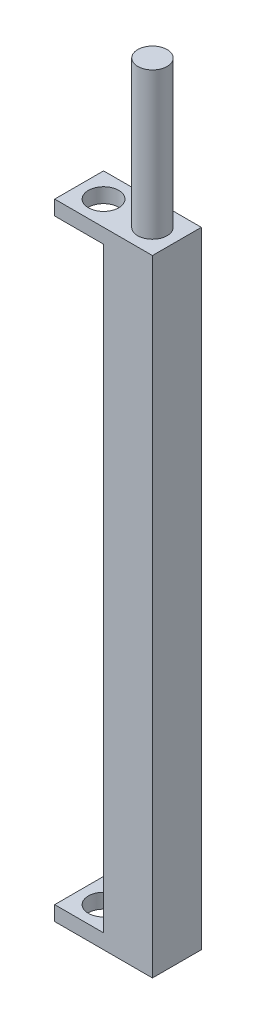
from build123d import *

# Parameters (mm, degrees)
SKETCH_2_W          = 10
SKETCH_2_H          = 5
EXTRUDE_1_DEPTH     = 1.5
SKETCH_3_R          = 1.55
CUT_EXTRUDE_1_DEPTH = 1.5
SKETCH_4_W          = 5
SKETCH_4_H          = 5
EXTRUDE_2_DEPTH     = 61
SKETCH_5_W          = 10
SKETCH_5_H          = 5
EXTRUDE_3_DEPTH     = 1.5
SKETCH_6_R          = 1.55
CUT_EXTRUDE_2_DEPTH = 1.5
SKETCH_7_R          = 1.5
EXTRUDE_4_DEPTH     = 15
SKETCH_11_R         = 1.55
CUT_EXTRUDE_3_DEPTH = 1


with BuildPart() as part:
    # 草图2 → 凸台-拉伸1 (new body)
    with BuildSketch(Plane(origin=(0, 0, 0), x_dir=(1, 0, 0), z_dir=(0, 1, 0))):
        Rectangle(SKETCH_2_W, SKETCH_2_H)
    extrude(amount=EXTRUDE_1_DEPTH)

    # 草图3 → 切除-拉伸1 (cut)
    with BuildSketch(Plane.XZ):
        with Locations((-2.5, 0)):
            Circle(SKETCH_3_R)
    extrude(amount=-CUT_EXTRUDE_1_DEPTH, mode=Mode.SUBTRACT)

    # 草图4 → 凸台-拉伸2 (add)
    with BuildSketch(Plane.XZ):
        with Locations((2.5, 0)):
            Rectangle(SKETCH_4_W, SKETCH_4_H)
    extrude(amount=EXTRUDE_2_DEPTH)

    # 草图5 → 凸台-拉伸3 (add)
    with BuildSketch(Plane.XZ.offset(61)):
        Rectangle(SKETCH_5_W, SKETCH_5_H)
    extrude(amount=EXTRUDE_3_DEPTH)

    # 草图6 → 切除-拉伸2 (cut)
    with BuildSketch(Plane.XZ.offset(62.5)):
        with Locations((-2.5, 0)):
            Circle(SKETCH_6_R)
    extrude(amount=-CUT_EXTRUDE_2_DEPTH, mode=Mode.SUBTRACT)

    # 草图7 → 凸台-拉伸4 (add)
    with BuildSketch(Plane(origin=(0, 1.5, 0), x_dir=(1, 0, 0), z_dir=(0, 1, 0))):
        with Locations((2.5, 0)):
            Circle(SKETCH_7_R)
    extrude(amount=EXTRUDE_4_DEPTH)

    # 草图11 → 切除-拉伸3 (cut)
    with BuildSketch(Plane.XZ.offset(62.5)):
        with Locations((2.5, 0)):
            Circle(SKETCH_11_R)
    extrude(amount=-CUT_EXTRUDE_3_DEPTH, mode=Mode.SUBTRACT)


solid = part.part
